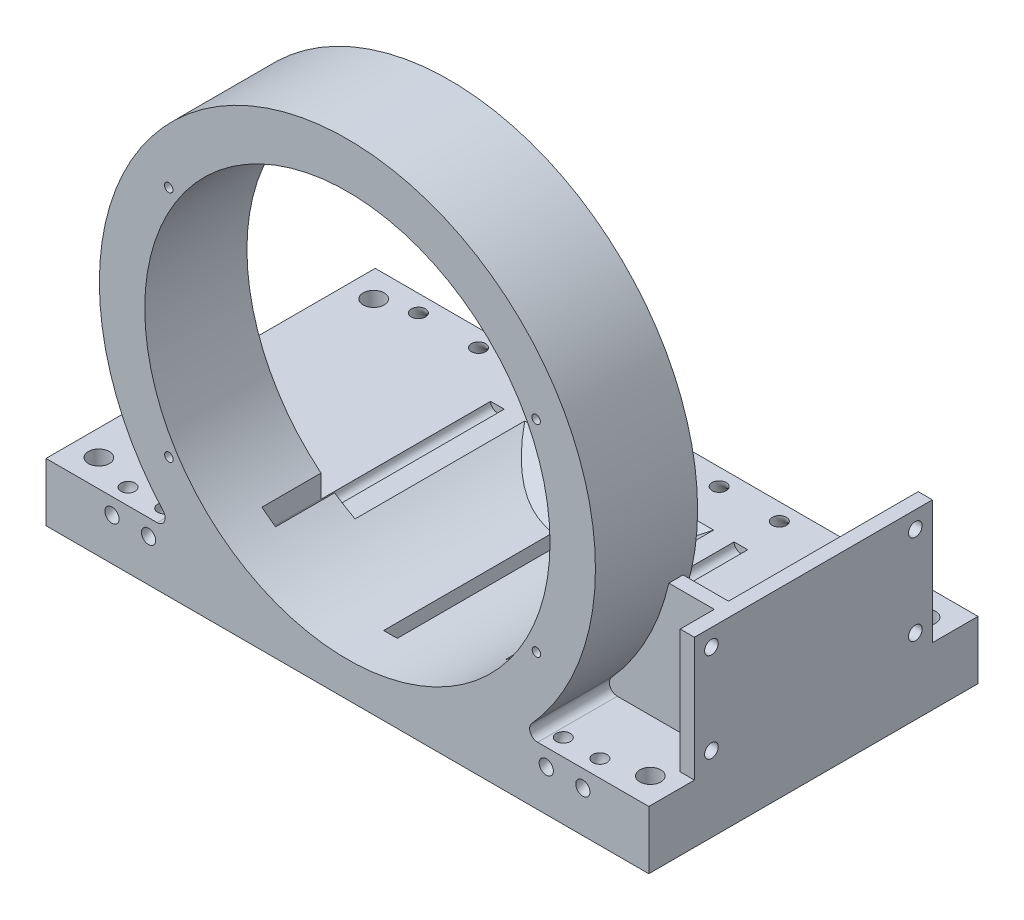
from build123d import *
from build123d.topology import SkipClean

# Parameters (mm, degrees)
SKETCH1_R            = 0.9525
BOSS_EXTRUDE1_DEPTH  = 22.86
BOSS_EXTRUDE2_START  = 50.8
BOSS_EXTRUDE2_DEPTH  = 50.8
CUT_EXTRUDE1_DEPTH   = 13.208
BOSS_EXTRUDE3_START  = -9.652
BOSS_EXTRUDE3_DEPTH  = 9.652
BOSS_EXTRUDE5_DEPTH  = 116.84
SKETCH7_R            = 2.3495
CUT_EXTRUDE2_DEPTH   = 25.4
SKETCH8_R            = 1.5875
SKETCH9_R            = 1.5875
FILLET1_R            = 1.778
CUT_EXTRUDE3_START   = -13.208
CUT_EXTRUDE3_DEPTH   = 13.208
CUT_EXTRUDE4_START   = -37.947685
SKETCH12_W           = 3.048
SKETCH12_H           = 5.76938411
CUT_EXTRUDE4_DEPTH   = 37.947685
BOSS_EXTRUDE6_START  = -22.86
BOSS_EXTRUDE6_DEPTH  = 22.86
BOSS_EXTRUDE8_DEPTH  = 3.175
BOSS_EXTRUDE9_DEPTH  = 3.175
BOSS_EXTRUDE10_DEPTH = 3.175
CUT_EXTRUDE5_DEPTH   = 13.208


with BuildPart() as part:
    # Sketch1 → Boss-Extrude1 (new body)
    with BuildSketch(Plane.XY):
        with BuildLine():
            Line((-11.793911232, 43.778174686), (-34.111734376, 43.778174686))
            ThreePointArc((-34.111734376, 43.778174686), (-55.42808501, 2.8047091), (-38.356610074, -40.111213702))
            Line((-38.356610074, -40.111213702), (-67.436307144, -40.111213702))
            Line((-67.436307144, -40.111213702), (-67.436307144, -53.154130962))
            Line((-67.436307144, -53.154130962), (67.436307144, -53.154130962))
            Line((67.436307144, -53.154130962), (67.436307144, -40.111213702))
            Line((67.436307144, -40.111213702), (38.356610074, -40.111213702))
            ThreePointArc((38.356610074, -40.111213702), (55.42808501, 2.8047091), (34.111734376, 43.778174686))
            Line((34.111734376, 43.778174686), (11.793911232, 43.778174686))
            ThreePointArc((11.793911232, 43.778174686), (44.365867188, 9.343165933), (28.448, -35.303487321))
            Line((28.448, -35.303487321), (28.448, -40.084313616))
            ThreePointArc((28.448, -40.084313616), (27.2415, -41.290813616), (26.035, -40.084313616))
            Line((26.035, -40.084313616), (26.035, -37.118778213))
            ThreePointArc((26.035, -37.118778213), (14.225045371, -43.049657434), (1.2065, -45.322944286))
            Line((1.2065, -45.322944286), (1.2065, -49.1871))
            ThreePointArc((1.2065, -49.1871), (0, -50.3936), (-1.2065, -49.1871))
            Line((-1.2065, -49.1871), (-1.2065, -45.322944286))
            ThreePointArc((-1.2065, -45.322944286), (-14.225045371, -43.049657434), (-26.035, -37.118778213))
            Line((-26.035, -37.118778213), (-26.035, -40.084313616))
            ThreePointArc((-26.035, -40.084313616), (-27.2415, -41.290813616), (-28.448, -40.084313616))
            Line((-28.448, -40.084313616), (-28.448, -35.303487321))
            ThreePointArc((-28.448, -35.303487321), (-44.365867188, 9.343165933), (-11.793911232, 43.778174686))
        make_face()
        with Locations((-39.930828715, -26.0985)):
            Circle(SKETCH1_R, mode=Mode.SUBTRACT)
        with Locations((42.298024836, -22.774758187)):
            Circle(SKETCH1_R, mode=Mode.SUBTRACT)
        with Locations((-39.989021015, 26.0985)):
            Circle(SKETCH1_R, mode=Mode.SUBTRACT)
        with Locations((42.219741997, 22.310241813)):
            Circle(SKETCH1_R, mode=Mode.SUBTRACT)
    extrude(amount=BOSS_EXTRUDE1_DEPTH)

    # Sketch2 → Boss-Extrude2 (add)
    with BuildSketch(Plane(origin=(0, 0, 0), x_dir=(-1, 0, 0), z_dir=(0, 0, -1)).offset(BOSS_EXTRUDE2_START)):
        with BuildLine():
            Line((21.135644215, -40.111213702), (26.035299919, -40.111213702))
            ThreePointArc((26.035299919, -40.111213702), (27.2415, -41.290813616), (28.447700081, -40.111213702))
            Line((28.447700081, -40.111213702), (67.436307144, -40.111213702))
            Line((67.436307144, -40.111213702), (67.436307144, -53.154130962))
            Line((67.436307144, -53.154130962), (-67.436307144, -53.154130962))
            Line((-67.436307144, -53.154130962), (-67.436307144, -40.111213702))
            Line((-67.436307144, -40.111213702), (-28.447700081, -40.111213702))
            ThreePointArc((-28.447700081, -40.111213702), (-27.2415, -41.290813616), (-26.035299919, -40.111213702))
            Line((-26.035299919, -40.111213702), (-21.135644215, -40.111213702))
            ThreePointArc((-21.135644215, -40.111213702), (-11.470980165, -43.863897855), (-1.2065, -45.322944286))
            Line((-1.2065, -45.322944286), (-1.2065, -49.1871))
            ThreePointArc((-1.2065, -49.1871), (0, -50.3936), (1.2065, -49.1871))
            Line((1.2065, -49.1871), (1.2065, -45.322944286))
            ThreePointArc((1.2065, -45.322944286), (11.470980165, -43.863897855), (21.135644215, -40.111213702))
        make_face()
    extrude(amount=-BOSS_EXTRUDE2_DEPTH)

    # Sketch3 → Cut-Extrude1 (cut)
    with BuildSketch(Plane(origin=(0, 0, 0), x_dir=(-1, 0, 0), z_dir=(0, 0, -1))):
        with BuildLine():
            Line((28.448, 35.303487321), (28.448, 40.255386447))
            ThreePointArc((28.448, 40.255386447), (27.2415, 41.461886447), (26.035, 40.255386447))
            Line((26.035, 40.255386447), (26.035469373, 40.221735647))
            Line((26.035469373, 40.221735647), (26.079183289, 37.08774892))
            ThreePointArc((26.079183289, 37.08774892), (27.278184081, 36.214991292), (28.448, 35.303487321))
        make_face()
        with BuildLine():
            Line((-26.035, 37.08774892), (-26.035, 40.255386447))
            ThreePointArc((-26.035, 40.255386447), (-27.2415, 41.461886447), (-28.448, 40.255386447))
            Line((-28.448, 40.255386447), (-28.448, 35.270861075))
            Line((-28.448, 35.270861075), (-26.035, 37.08774892))
        make_face()
    extrude(amount=-CUT_EXTRUDE1_DEPTH, mode=Mode.SUBTRACT)

    # Sketch4 → Boss-Extrude3 (add)
    with SkipClean():  # the faces are left unmerged after this step: merging them gives an invalid solid
        with BuildSketch(Plane.XY.offset(22.86).offset(BOSS_EXTRUDE3_START)):
            with BuildLine():
                ThreePointArc((-28.448, -35.303487321), (-27.25661649, -36.231226566), (-26.035, -37.118778213))
                Line((-26.035, -37.118778213), (-26.035, -40.084313616))
                ThreePointArc((-26.035, -40.084313616), (-27.2415, -41.290813616), (-28.448, -40.084313616))
                Line((-28.448, -40.084313616), (-28.448, -35.303487321))
            make_face()
            with BuildLine():
                ThreePointArc((-1.2065, -45.322944286), (0, -45.339), (1.2065, -45.322944286))
                Line((1.2065, -45.322944286), (1.2065, -49.1871))
                ThreePointArc((1.2065, -49.1871), (0, -50.3936), (-1.2065, -49.1871))
                Line((-1.2065, -49.1871), (-1.2065, -45.322944286))
            make_face()
            with BuildLine():
                ThreePointArc((26.035, -37.118778213), (27.25661649, -36.231226566), (28.448, -35.303487321))
                Line((28.448, -35.303487321), (28.448, -40.084313616))
                ThreePointArc((28.448, -40.084313616), (27.2415, -41.290813616), (26.035, -40.084313616))
                Line((26.035, -40.084313616), (26.035, -37.118778213))
            make_face()
        extrude(amount=BOSS_EXTRUDE3_DEPTH)

    # Sketch6 → Boss-Extrude5 (add)
    with SkipClean():  # the faces are left unmerged after this step: merging them gives an invalid solid
        with BuildSketch(Plane(origin=(67.436307144, 0, 0), x_dir=(0, 0, -1), z_dir=(1, 0, 0))):
            Polygon((20.818923361, -46.823556488), (20.818923361, -53.154130962), (50.8, -53.154130962), (50.8, -45.397570332), (50.8, -40.111213702), (37.947684683, -40.111213702), align=None)
        extrude(amount=-BOSS_EXTRUDE5_DEPTH)

    # Sketch7 → Cut-Extrude2 (cut)
    with SkipClean():  # the faces are left unmerged after this step: merging them gives an invalid solid
        with BuildSketch(Plane.XZ.offset(53.154130962)):
            with Locations(Location((-61.69105058, 16.766144014, 0), (0, 0, 270))):
                Circle(SKETCH7_R)
            with Locations(Location((61.69105058, -44.706144014, 0), (0, 0, 270))):
                Circle(SKETCH7_R)
            with Locations(Location((-61.69105058, -44.706144014, 0), (0, 0, 270))):
                Circle(SKETCH7_R)
            with Locations(Location((61.69105058, 16.766144014, 0), (0, 0, 270))):
                Circle(SKETCH7_R)
        extrude(amount=-CUT_EXTRUDE2_DEPTH, mode=Mode.SUBTRACT)

    # Sketch8 → Cut-Revolve1 (revolve, cut)
    with SkipClean():  # the faces are left unmerged after this step: merging them gives an invalid solid
        with BuildSketch(Plane(origin=(0, -40.111213702, 0), x_dir=(1, 0, 0), z_dir=(0, 1, 0)), mode=Mode.PRIVATE) as cut_revolve1_sk:
            with Locations((-53.974307144, 46.99)):
                Circle(SKETCH8_R)
            with Locations((-40.512307144, 46.99)):
                Circle(SKETCH8_R)
            with Locations((-27.050307144, 46.99)):
                Circle(SKETCH8_R)
            with Locations((-13.588307144, 46.99)):
                Circle(SKETCH8_R)
            with Locations((-0.126307144, 46.99)):
                Circle(SKETCH8_R)
            with Locations((13.335692856, 46.99)):
                Circle(SKETCH8_R)
            with Locations((26.797692856, 46.99)):
                Circle(SKETCH8_R)
            with Locations((40.259692856, 46.99)):
                Circle(SKETCH8_R)
            with Locations((53.721692856, 46.99)):
                Circle(SKETCH8_R)
        revolve(cut_revolve1_sk.sketch.rotate(Axis((-67.436307144, -40.111213702, -50.8), (1, 0, 0)), 45), axis=Axis((-67.436307144, -40.111213702, -50.8), (1, 0, 0)), mode=Mode.SUBTRACT)

    # Sketch9 → Cut-Revolve2 (revolve, cut)
    with SkipClean():  # the faces are left unmerged after this step: merging them gives an invalid solid
        with BuildSketch(Plane(origin=(0, -40.111213702, 0), x_dir=(1, 0, 0), z_dir=(0, 1, 0)), mode=Mode.PRIVATE) as cut_revolve2_sk:
            with Locations((44.497829915, -19.05)):
                Circle(SKETCH9_R)
            with Locations((52.680759305, -19.05)):
                Circle(SKETCH9_R)
            with Locations((-52.680354677, -19.256475487)):
                Circle(SKETCH9_R)
            with Locations((-44.497488138, -19.224403544)):
                Circle(SKETCH9_R)
        revolve(cut_revolve2_sk.sketch.rotate(Axis((-52.680354677, -40.111213702, 22.86), (1, 0, 0)), 315), axis=Axis((-52.680354677, -40.111213702, 22.86), (1, 0, 0)), mode=Mode.SUBTRACT)

    # Fillet1
    fillet1_edges = [part.edges().sort_by_distance(p)[0] for p in [
        (38.356610074, -40.111213702, 11.43),
        (-38.356610074, -40.111213702, 11.43),
    ]]
    fillet(fillet1_edges, radius=FILLET1_R)

    # Sketch11 → Cut-Extrude3 (cut)
    with SkipClean():  # the faces are left unmerged after this step: merging them gives an invalid solid
        with BuildSketch(Plane(origin=(0, 0, 0), x_dir=(-1, 0, 0), z_dir=(0, 0, -1)).offset(CUT_EXTRUDE3_START)):
            with BuildLine():
                ThreePointArc((28.7655, -35.045269734), (28.607041347, -35.174736763), (28.448, -35.303487321))
                Line((28.448, -35.303487321), (28.448, -40.084313616))
                ThreePointArc((28.448, -40.084313616), (27.2415, -41.290813616), (26.035, -40.084313616))
                Line((26.035, -40.084313616), (26.035, -37.118778213))
                ThreePointArc((26.035, -37.118778213), (25.876485251, -37.22945651), (25.7175, -37.33945788))
                Line((25.7175, -37.33945788), (25.7175, -40.084313616))
                ThreePointArc((25.7175, -40.084313616), (27.2415, -41.608313616), (28.7655, -40.084313616))
                Line((28.7655, -40.084313616), (28.7655, -35.045269734))
            make_face()
            with BuildLine():
                ThreePointArc((28.448, 35.303487321), (28.638920629, 35.148785843), (28.829, 34.993051882))
                Line((28.829, 34.993051882), (28.829, 40.255386447))
                ThreePointArc((28.829, 40.255386447), (27.2415, 41.842886447), (25.654, 40.255386447))
                Line((25.654, 40.255386447), (25.654, 37.383113902))
                ThreePointArc((25.654, 37.383113902), (25.86701323, 37.23603829), (26.079183289, 37.08774892))
                Line((26.079183289, 37.08774892), (26.035, 40.255386447))
                ThreePointArc((26.035, 40.255386447), (27.2415, 41.461886447), (28.448, 40.255386447))
                Line((28.448, 40.255386447), (28.448, 35.303487321))
            make_face()
            with BuildLine():
                Line((1.524, -49.1871), (1.524, -45.313379316))
                ThreePointArc((1.524, -45.313379316), (1.365258377, -45.318439851), (1.2065, -45.322944286))
                Line((1.2065, -45.322944286), (1.2065, -49.1871))
                ThreePointArc((1.2065, -49.1871), (0, -50.3936), (-1.2065, -49.1871))
                Line((-1.2065, -49.1871), (-1.2065, -45.322944286))
                ThreePointArc((-1.2065, -45.322944286), (-1.365258377, -45.318439851), (-1.524, -45.313379316))
                Line((-1.524, -45.313379316), (-1.524, -49.1871))
                ThreePointArc((-1.524, -49.1871), (0, -50.7111), (1.524, -49.1871))
            make_face()
            with BuildLine():
                ThreePointArc((-26.035, 37.118778213), (-25.844837949, 37.251433159), (-25.654, 37.383113902))
                Line((-25.654, 37.383113902), (-25.654, 40.255386447))
                ThreePointArc((-25.654, 40.255386447), (-27.2415, 41.842886447), (-28.829, 40.255386447))
                Line((-28.829, 40.255386447), (-28.829, 34.993051882))
                ThreePointArc((-28.829, 34.993051882), (-28.638920629, 35.148785843), (-28.448, 35.303487321))
                Line((-28.448, 35.303487321), (-28.448, 40.255386447))
                ThreePointArc((-28.448, 40.255386447), (-27.2415, 41.461886447), (-26.035, 40.255386447))
                Line((-26.035, 40.255386447), (-26.035, 37.118778213))
            make_face()
            with BuildLine():
                Line((-25.7175, -40.084313616), (-25.7175, -37.33945788))
                ThreePointArc((-25.7175, -37.33945788), (-25.876485251, -37.22945651), (-26.035, -37.118778213))
                Line((-26.035, -37.118778213), (-26.035, -40.084313616))
                ThreePointArc((-26.035, -40.084313616), (-27.2415, -41.290813616), (-28.448, -40.084313616))
                Line((-28.448, -40.084313616), (-28.448, -35.303487321))
                ThreePointArc((-28.448, -35.303487321), (-28.607041347, -35.174736763), (-28.7655, -35.045269734))
                Line((-28.7655, -35.045269734), (-28.7655, -40.084313616))
                ThreePointArc((-28.7655, -40.084313616), (-27.2415, -41.608313616), (-25.7175, -40.084313616))
            make_face()
        extrude(amount=CUT_EXTRUDE3_DEPTH, mode=Mode.SUBTRACT)

    # Sketch12 → Cut-Extrude4 (cut)
    with SkipClean():  # the faces are left unmerged after this step: merging them gives an invalid solid
        with BuildSketch(Plane.XY.offset(CUT_EXTRUDE4_START)):
            with BuildLine():
                Line((26.035299919, -40.111213702), (28.447700081, -40.111213702))
                ThreePointArc((28.447700081, -40.111213702), (27.2415, -41.290813616), (26.035299919, -40.111213702))
            make_face()
            with BuildLine():
                Line((26.035299919, -40.111213702), (25.717737425, -40.111213702))
                ThreePointArc((25.717737425, -40.111213702), (27.2415, -41.608313616), (28.765262575, -40.111213702))
                Line((28.765262575, -40.111213702), (28.447700081, -40.111213702))
                ThreePointArc((28.447700081, -40.111213702), (27.2415, -41.290813616), (26.035299919, -40.111213702))
            make_face()
            with BuildLine():
                Line((1.524, -49.1871), (1.524, -45.313379316))
                ThreePointArc((1.524, -45.313379316), (1.365258377, -45.318439851), (1.2065, -45.322944286))
                Line((1.2065, -45.322944286), (1.2065, -49.1871))
                ThreePointArc((1.2065, -49.1871), (0, -50.3936), (-1.2065, -49.1871))
                Line((-1.2065, -49.1871), (-1.2065, -45.322944286))
                ThreePointArc((-1.2065, -45.322944286), (-1.365258377, -45.318439851), (-1.524, -45.313379316))
                Line((-1.524, -45.313379316), (-1.524, -49.1871))
                ThreePointArc((-1.524, -49.1871), (0, -50.7111), (1.524, -49.1871))
            make_face()
            with BuildLine():
                Line((-1.2065, -45.322944286), (1.2065, -45.322944286))
                Line((1.2065, -45.322944286), (1.2065, -49.1871))
                ThreePointArc((1.2065, -49.1871), (0, -50.3936), (-1.2065, -49.1871))
                Line((-1.2065, -49.1871), (-1.2065, -45.322944286))
            make_face()
            with BuildLine():
                Line((-28.447700081, -40.111213702), (-28.765262575, -40.111213702))
                ThreePointArc((-28.765262575, -40.111213702), (-27.2415, -41.608313616), (-25.717737425, -40.111213702))
                Line((-25.717737425, -40.111213702), (-26.035299919, -40.111213702))
                ThreePointArc((-26.035299919, -40.111213702), (-27.2415, -41.290813616), (-28.447700081, -40.111213702))
            make_face()
            with BuildLine():
                Line((-28.447700081, -40.111213702), (-26.035299919, -40.111213702))
                ThreePointArc((-26.035299919, -40.111213702), (-27.2415, -41.290813616), (-28.447700081, -40.111213702))
            make_face()
            with BuildLine():
                Line((1.524, -45.313379316), (-1.524, -45.313379316))
                ThreePointArc((-1.524, -45.313379316), (-1.365258377, -45.318439851), (-1.2065, -45.322944286))
                Line((-1.2065, -45.322944286), (1.2065, -45.322944286))
                ThreePointArc((1.2065, -45.322944286), (1.365258377, -45.318439851), (1.524, -45.313379316))
            make_face()
            with Locations((0, -42.428687261)):
                Rectangle(SKETCH12_W, SKETCH12_H)
        extrude(amount=CUT_EXTRUDE4_DEPTH, mode=Mode.SUBTRACT)

    # Sketch13 → Boss-Extrude6 (add)
    with SkipClean():  # the faces are left unmerged after this step: merging them gives an invalid solid
        with BuildSketch(Plane(origin=(0, 0, 0), x_dir=(-1, 0, 0), z_dir=(0, 0, -1)).offset(BOSS_EXTRUDE6_START)):
            with BuildLine():
                ThreePointArc((34.111734376, 43.778174686), (0, 55.499), (-34.111734376, 43.778174686))
                Line((-34.111734376, 43.778174686), (-11.793911232, 43.778174686))
                ThreePointArc((-11.793911232, 43.778174686), (0, 45.339), (11.793911232, 43.778174686))
                Line((11.793911232, 43.778174686), (34.111734376, 43.778174686))
            make_face()
        extrude(amount=BOSS_EXTRUDE6_DEPTH)

    # Sketch14 → Boss-Extrude8 (add)
    with SkipClean():  # the faces are left unmerged after this step: merging them gives an invalid solid
        with BuildSketch(Plane(origin=(67.436307144, 0, 0), x_dir=(0, 0, -1), z_dir=(1, 0, 0))):
            with BuildLine():
                Line((13.97, -36.301213702), (13.97, -40.111213702))
                Line((13.97, -40.111213702), (40.5892, -40.111213702))
                Line((40.5892, -40.111213702), (40.5892, -12.425213702))
                Line((40.5892, -12.425213702), (13.97, -12.425213702))
                Line((13.97, -12.425213702), (13.97, -16.235213702))
                Line((13.97, -16.235213702), (35.2552, -16.235213702))
                ThreePointArc((35.2552, -16.235213702), (36.7792, -14.711213702), (38.3032, -16.235213702))
                ThreePointArc((38.3032, -16.235213702), (37.856830735, -17.312844436), (36.7792, -17.759213702))
                Line((36.7792, -17.759213702), (36.7792, -34.777213702))
                ThreePointArc((36.7792, -34.777213702), (37.856830735, -35.223582967), (38.3032, -36.301213702))
                ThreePointArc((38.3032, -36.301213702), (36.7792, -37.825213702), (35.2552, -36.301213702))
                Line((35.2552, -36.301213702), (13.97, -36.301213702))
            make_face()
            with BuildLine():
                Line((-12.6492, -40.111213702), (13.97, -40.111213702))
                Line((13.97, -40.111213702), (13.97, -36.301213702))
                Line((13.97, -36.301213702), (-7.3152, -36.301213702))
                ThreePointArc((-7.3152, -36.301213702), (-9.916830735, -37.378844436), (-8.8392, -34.777213702))
                Line((-8.8392, -34.777213702), (-8.8392, -17.759213702))
                ThreePointArc((-8.8392, -17.759213702), (-9.916830735, -15.157582967), (-7.3152, -16.235213702))
                Line((-7.3152, -16.235213702), (13.97, -16.235213702))
                Line((13.97, -16.235213702), (13.97, -12.425213702))
                Line((13.97, -12.425213702), (-12.6492, -12.425213702))
                Line((-12.6492, -12.425213702), (-12.6492, -40.111213702))
            make_face()
            with BuildLine():
                Line((-7.3152, -36.301213702), (13.97, -36.301213702))
                Line((13.97, -36.301213702), (13.97, -16.235213702))
                Line((13.97, -16.235213702), (-7.3152, -16.235213702))
                ThreePointArc((-7.3152, -16.235213702), (-7.761569265, -17.312844436), (-8.8392, -17.759213702))
                Line((-8.8392, -17.759213702), (-8.8392, -34.777213702))
                ThreePointArc((-8.8392, -34.777213702), (-7.761569265, -35.223582967), (-7.3152, -36.301213702))
            make_face()
            with BuildLine():
                Line((13.97, -16.235213702), (13.97, -36.301213702))
                Line((13.97, -36.301213702), (35.2552, -36.301213702))
                ThreePointArc((35.2552, -36.301213702), (35.701569265, -35.223582967), (36.7792, -34.777213702))
                Line((36.7792, -34.777213702), (36.7792, -17.759213702))
                ThreePointArc((36.7792, -17.759213702), (35.701569265, -17.312844436), (35.2552, -16.235213702))
                Line((35.2552, -16.235213702), (13.97, -16.235213702))
            make_face()
        extrude(amount=-BOSS_EXTRUDE8_DEPTH)

    # Sketch16 → Boss-Extrude9 (add)
    with SkipClean():  # the faces are left unmerged after this step: merging them gives an invalid solid
        with BuildSketch(Plane.XY.offset(5.0292)):
            with BuildLine():
                Line((42.558424035, -40.111213702), (64.261307144, -40.111213702))
                Line((64.261307144, -40.111213702), (64.261307144, -12.425213702))
                Line((64.261307144, -12.425213702), (54.090230777, -12.425213702))
                ThreePointArc((54.090230777, -12.425213702), (49.24003502, -25.603865962), (41.237319963, -37.143269152))
                ThreePointArc((41.237319963, -37.143269152), (40.93407718, -39.056249866), (42.558424035, -40.111213702))
            make_face()
        extrude(amount=-BOSS_EXTRUDE9_DEPTH)

    # Sketch17 → Boss-Extrude10 (add)
    with SkipClean():  # the faces are left unmerged after this step: merging them gives an invalid solid
        with BuildSketch(Plane(origin=(0, 0, -32.9692), x_dir=(-1, 0, 0), z_dir=(0, 0, -1))):
            Polygon((-64.261307144, -40.111213702), (-43.88631891, -40.111213702), (-64.261307144, -12.425213702), align=None)
        extrude(amount=-BOSS_EXTRUDE10_DEPTH)

    # Sketch18 → Cut-Extrude5 (cut)
    with SkipClean():  # the faces are left unmerged after this step: merging them gives an invalid solid
        with BuildSketch(Plane(origin=(0, 0, 0), x_dir=(-1, 0, 0), z_dir=(0, 0, -1))):
            with BuildLine():
                Line((-1.524, 45.313379316), (-1.524, 45.231166457))
                Line((-1.524, 45.231166457), (-1.524, 41.21883073))
                Line((-1.524, 41.21883073), (1.524, 41.21883073))
                Line((1.524, 41.21883073), (1.524, 45.231166457))
                Line((1.524, 45.231166457), (1.524, 45.313379316))
                ThreePointArc((1.524, 45.313379316), (0, 45.339), (-1.524, 45.313379316))
            make_face()
            with BuildLine():
                Line((-1.524, 49.104887141), (-1.524, 45.313379316))
                ThreePointArc((-1.524, 45.313379316), (0, 45.339), (1.524, 45.313379316))
                Line((1.524, 45.313379316), (1.524, 49.104887141))
                ThreePointArc((1.524, 49.104887141), (0, 50.628887141), (-1.524, 49.104887141))
            make_face()
        extrude(amount=-CUT_EXTRUDE5_DEPTH, mode=Mode.SUBTRACT)


solid = part.part
